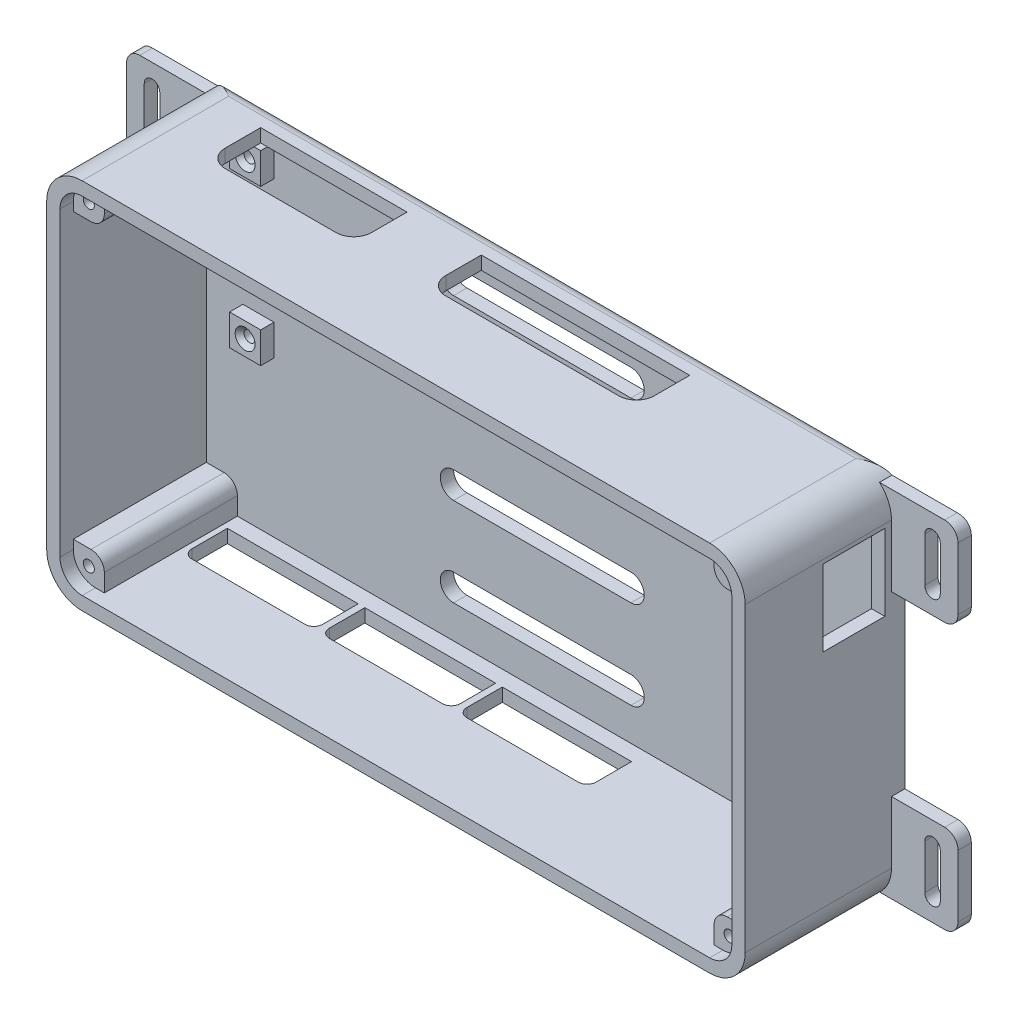
from build123d import *

# Parameters (mm, degrees)
SCHIZZO2_W                     = 151.5
SCHIZZO2_H                     = 78
ESTRUSIONE_ESTRUSIONE1_DEPTH   = 33
SCHIZZO2_3_R                   = 1.25
ESTRUSIONE_ESTRUSIONE2_DEPTH   = 30
TAGLIO_ESTRUSIONE1_DEPTH       = 3
TAGLIO_ESTRUSIONE2_REACH       = 168.311
SCHIZZO4_W                     = 14
SCHIZZO4_H                     = 17.18368822
SCHIZZO6_W                     = 7
SCHIZZO6_H                     = 7
SCHIZZO6_R                     = 1.25
ESTRUSIONE_ESTRUSIONE3_DEPTH   = 3
ESTRUSIONE_ESTRUSIONE3_2_DEPTH = 3
ESTRUSIONE_ESTRUSIONE3_3_DEPTH = 3
ESTRUSIONE_ESTRUSIONE3_4_DEPTH = 3
SMUSSO1_SIZE                   = 1
SMUSSO2_SIZE                   = 1
SMUSSO3_SIZE                   = 1
SMUSSO4_SIZE                   = 1
TAGLIO_ESTRUSIONE3_DEPTH       = 3
SCHIZZO7_W                     = 157.5
SCHIZZO7_H                     = 84
ESTRUSIONE_ESTRUSIONE4_DEPTH   = 3
SCHIZZO8_R                     = 1.25
TAGLIO_ESTRUSIONE4_DEPTH       = 13
ESTRUSIONE_ESTRUSIONE5_DEPTH   = 3
RACCORDO2_R                    = 8
RACCORDO3_R                    = 5
RACCORDO4_R                    = 5
RACCORDO5_R                    = 8
RACCORDO8_START                = -94
RACCORDO8_DEPTH                = 188
TAGLIO_ESTRUSIONE5_DEPTH       = 10


with BuildPart() as part:
    # Schizzo2 → Estrusione-Estrusione1 (new body)
    with BuildSketch(Plane.XY):
        Polygon((-78.75, 39), (-78.75, 42), (78.75, 42), (78.75, 39), (78.75, -39), (78.75, -42), (-78.75, -42), (-78.75, -39), align=None)
        Rectangle(SCHIZZO2_W, SCHIZZO2_H, mode=Mode.SUBTRACT)
    extrude(amount=ESTRUSIONE_ESTRUSIONE1_DEPTH)

    # Schizzo2<3> → Estrusione-Estrusione2 (add)
    # profile 1 of 4: a face of its own
    with BuildSketch(Plane.XY):
        with BuildLine():
            Line((68.75, -39), (75.75, -39))
            Line((75.75, -39), (75.75, -32))
            Line((75.75, -32), (71.75, -32))
            ThreePointArc((71.75, -32), (69.628679656, -32.878679656), (68.75, -35))
            Line((68.75, -35), (68.75, -39))
        make_face()
        with Locations((72.25, -35.5)):
            Circle(SCHIZZO2_3_R, mode=Mode.SUBTRACT)
    # profile 2 of 4: a face of its own
    with BuildSketch(Plane.XY):
        with BuildLine():
            Line((-75.75, -39), (-68.75, -39))
            Line((-68.75, -39), (-68.75, -35))
            ThreePointArc((-68.75, -35), (-69.628679656, -32.878679656), (-71.75, -32))
            Line((-71.75, -32), (-75.75, -32))
            Line((-75.75, -32), (-75.75, -39))
        make_face()
        with Locations((-72.25, -35.5)):
            Circle(SCHIZZO2_3_R, mode=Mode.SUBTRACT)
    # profile 3 of 4: a face of its own
    with BuildSketch(Plane.XY):
        with BuildLine():
            Line((71.75, 32), (75.75, 32))
            Line((75.75, 32), (75.75, 39))
            Line((75.75, 39), (68.75, 39))
            Line((68.75, 39), (68.75, 35))
            ThreePointArc((68.75, 35), (69.628679656, 32.878679656), (71.75, 32))
        make_face()
        with Locations((72.25, 35.5)):
            Circle(SCHIZZO2_3_R, mode=Mode.SUBTRACT)
    # profile 4 of 4: a face of its own
    with BuildSketch(Plane.XY):
        with BuildLine():
            Line((-75.75, 39), (-75.75, 32))
            Line((-75.75, 32), (-71.75, 32))
            ThreePointArc((-71.75, 32), (-69.628679656, 32.878679656), (-68.75, 35))
            Line((-68.75, 35), (-68.75, 39))
            Line((-68.75, 39), (-75.75, 39))
        make_face()
        with Locations((-72.25, 35.5)):
            Circle(SCHIZZO2_3_R, mode=Mode.SUBTRACT)
    extrude(amount=ESTRUSIONE_ESTRUSIONE2_DEPTH)

    # Schizzo3 → Taglio-Estrusione1 (cut)
    with BuildSketch(Plane(origin=(0, 42, 0), x_dir=(1, 0, 0), z_dir=(0, 1, 0))):
        with BuildLine():
            Line((-61, -2.5), (-61, -10.5))
            ThreePointArc((-61, -10.5), (-59.828427125, -13.328427125), (-57, -14.5))
            Line((-57, -14.5), (-32, -14.5))
            ThreePointArc((-32, -14.5), (-29.171572875, -13.328427125), (-28, -10.5))
            Line((-28, -10.5), (-28, -2.5))
            Line((-28, -2.5), (-61, -2.5))
        make_face()
        with BuildLine():
            Line((-11.25, -2.5), (-11.25, -10.5))
            ThreePointArc((-11.25, -10.5), (-10.078427125, -13.328427125), (-7.25, -14.5))
            Line((-7.25, -14.5), (31.75, -14.5))
            ThreePointArc((31.75, -14.5), (34.578427125, -13.328427125), (35.75, -10.5))
            Line((35.75, -10.5), (35.75, -2.5))
            Line((35.75, -2.5), (-11.25, -2.5))
        make_face()
    extrude(amount=-TAGLIO_ESTRUSIONE1_DEPTH, mode=Mode.SUBTRACT)

    # Taglio-Estrusione2: up to this face of the body (flat: up to its plane)
    taglio_estrusione2_end = Plane(part.part.faces().sort_by_distance((68.75, 37, 15))[0])
    # Schizzo4 → Taglio-Estrusione2 (cut, up to the picked face)
    with BuildSketch(Plane(origin=(78.75, 0, 0), x_dir=(0, 0, -1), z_dir=(1, 0, 0)), mode=Mode.PRIVATE) as taglio_estrusione2_sk1:
        with Locations((-8.5, 24.524535237)):
            Rectangle(SCHIZZO4_W, SCHIZZO4_H)
    taglio_estrusione2_tool1 = split(extrude(taglio_estrusione2_sk1.sketch, amount=-TAGLIO_ESTRUSIONE2_REACH, mode=Mode.PRIVATE), bisect_by=taglio_estrusione2_end, keep=Keep.BOTH, mode=Mode.PRIVATE)
    add(taglio_estrusione2_tool1.solids().sort_by(Axis((78.75, 24.524535, 8.5), (-1, 0, 0)))[0], mode=Mode.SUBTRACT)

    # Schizzo5 → Taglio-Estrusione3 (cut)
    with BuildSketch(Plane.XZ.offset(42)):
        with BuildLine():
            Line((-67.507731835, 3.5), (-67.507731835, 11.5))
            ThreePointArc((-67.507731835, 11.5), (-66.921945398, 12.914213562), (-65.507731835, 13.5))
            Line((-65.507731835, 13.5), (-55.507731835, 13.5))
            Line((-55.507731835, 13.5), (-50.007731835, 13.5))
            Line((-50.007731835, 13.5), (-40.007731835, 13.5))
            ThreePointArc((-40.007731835, 13.5), (-38.593518273, 12.914213562), (-38.007731835, 11.5))
            Line((-38.007731835, 11.5), (-38.007731835, 3.5))
            Line((-38.007731835, 3.5), (-67.507731835, 3.5))
        make_face()
        with BuildLine():
            Line((23.630484333, 3.5), (23.630484333, 11.5))
            ThreePointArc((23.630484333, 11.5), (23.044697895, 12.914213562), (21.630484333, 13.5))
            Line((21.630484333, 13.5), (11.992268165, 13.5))
            Line((11.992268165, 13.5), (-3.507731835, 13.5))
            ThreePointArc((-3.507731835, 13.5), (-4.921945398, 12.914213562), (-5.507731835, 11.5))
            Line((-5.507731835, 11.5), (-5.507731835, 3.5))
            Line((-5.507731835, 3.5), (9.992268165, 3.5))
            Line((9.992268165, 3.5), (23.630484333, 3.5))
        make_face()
        with BuildLine():
            Line((-36.507731835, 3.5), (-36.507731835, 11.5))
            ThreePointArc((-36.507731835, 11.5), (-35.921945398, 12.914213562), (-34.507731835, 13.5))
            Line((-34.507731835, 13.5), (-19.007731835, 13.5))
            Line((-19.007731835, 13.5), (-9.007731835, 13.5))
            ThreePointArc((-9.007731835, 13.5), (-7.593518273, 12.914213562), (-7.007731835, 11.5))
            Line((-7.007731835, 11.5), (-7.007731835, 3.5))
            Line((-7.007731835, 3.5), (-21.007731835, 3.5))
            Line((-21.007731835, 3.5), (-36.507731835, 3.5))
        make_face()
    extrude(amount=-TAGLIO_ESTRUSIONE3_DEPTH, mode=Mode.SUBTRACT)



with BuildPart() as body_2:
    # Schizzo6 → Estrusione-Estrusione3 (new body)
    with BuildSketch(Plane(origin=(0, 0, 0), x_dir=(-1, 0, 0), z_dir=(0, 0, -1))):
        with Locations((64, 34.5)):
            Rectangle(SCHIZZO6_W, SCHIZZO6_H)
        with Locations((64, 34.5)):
            Circle(SCHIZZO6_R, mode=Mode.SUBTRACT)
    extrude(amount=-ESTRUSIONE_ESTRUSIONE3_DEPTH)

    # Smusso1
    smusso1_edges = [body_2.edges().sort_by_distance(p)[0] for p in [
        (-62.75, 34.5, 3),
    ]]
    chamfer(smusso1_edges, length=SMUSSO1_SIZE)


with BuildPart() as body_3:
    # Schizzo6 → Estrusione-Estrusione3 2 (new body)
    with BuildSketch(Plane(origin=(0, 0, 0), x_dir=(-1, 0, 0), z_dir=(0, 0, -1))):
        with Locations((64, -0.5)):
            Rectangle(SCHIZZO6_W, SCHIZZO6_H)
        with Locations((64, -0.5)):
            Circle(SCHIZZO6_R, mode=Mode.SUBTRACT)
    extrude(amount=-ESTRUSIONE_ESTRUSIONE3_2_DEPTH)

    # Smusso2
    smusso2_edges = [body_3.edges().sort_by_distance(p)[0] for p in [
        (-62.75, -0.5, 3),
    ]]
    chamfer(smusso2_edges, length=SMUSSO2_SIZE)


with BuildPart() as body_4:
    # Schizzo6 → Estrusione-Estrusione3 3 (new body)
    with BuildSketch(Plane(origin=(0, 0, 0), x_dir=(-1, 0, 0), z_dir=(0, 0, -1))):
        with Locations((-64, 34.5)):
            Rectangle(SCHIZZO6_W, SCHIZZO6_H)
        with Locations(Location((-64, 34.5, 0), (0, 0, 180))):
            Circle(SCHIZZO6_R, mode=Mode.SUBTRACT)
    extrude(amount=-ESTRUSIONE_ESTRUSIONE3_3_DEPTH)

    # Smusso3
    smusso3_edges = [body_4.edges().sort_by_distance(p)[0] for p in [
        (62.75, 34.5, 3),
    ]]
    chamfer(smusso3_edges, length=SMUSSO3_SIZE)


with BuildPart() as body_5:
    # Schizzo6 → Estrusione-Estrusione3 4 (new body)
    with BuildSketch(Plane(origin=(0, 0, 0), x_dir=(-1, 0, 0), z_dir=(0, 0, -1))):
        with Locations((-64, -34.5)):
            Rectangle(SCHIZZO6_W, SCHIZZO6_H)
        with Locations((-64, -34.5)):
            Circle(SCHIZZO6_R, mode=Mode.SUBTRACT)
    extrude(amount=-ESTRUSIONE_ESTRUSIONE3_4_DEPTH)

    # Smusso4
    smusso4_edges = [body_5.edges().sort_by_distance(p)[0] for p in [
        (65.25, -34.5, 3),
    ]]
    chamfer(smusso4_edges, length=SMUSSO4_SIZE)


with BuildPart() as part_1:
    add(part.part)

    add(body_2.part)  # Estrusione-Estrusione4 merges body 2

    add(body_3.part)  # Estrusione-Estrusione4 merges body 3

    add(body_4.part)  # Estrusione-Estrusione4 merges body 4

    add(body_5.part)  # Estrusione-Estrusione4 merges body 5
    # Schizzo7 → Estrusione-Estrusione4 (add)
    with BuildSketch(Plane(origin=(0, 0, 0), x_dir=(-1, 0, 0), z_dir=(0, 0, -1))):
        Rectangle(SCHIZZO7_W, SCHIZZO7_H)
    extrude(amount=ESTRUSIONE_ESTRUSIONE4_DEPTH)

    # Schizzo8 → Taglio-Estrusione4 (cut)
    with BuildSketch(Plane(origin=(0, 0, -3), x_dir=(-1, 0, 0), z_dir=(0, 0, -1))):
        with Locations((-64, 34.5)):
            Circle(SCHIZZO8_R)
        with Locations((64, 34.5)):
            Circle(SCHIZZO8_R)
        with Locations((64, -0.5)):
            Circle(SCHIZZO8_R)
        with Locations((-64, -34.5)):
            Circle(SCHIZZO8_R)
    extrude(amount=-TAGLIO_ESTRUSIONE4_DEPTH, mode=Mode.SUBTRACT)

    # Schizzo9 → Estrusione-Estrusione5 (add)
    # profile 1 of 4: a face of its own
    with BuildSketch(Plane(origin=(0, 0, -3), x_dir=(-1, 0, 0), z_dir=(0, 0, -1))):
        with BuildLine():
            Line((-78.75, 20), (-78.75, 40))
            Line((-78.75, 40), (-90.75, 40))
            ThreePointArc((-90.75, 40), (-92.871320344, 39.121320344), (-93.75, 37))
            Line((-93.75, 37), (-93.75, 23))
            ThreePointArc((-93.75, 23), (-92.871320344, 20.878679656), (-90.75, 20))
            Line((-90.75, 20), (-78.75, 20))
        make_face()
        with BuildLine():
            Line((-89.75, 25), (-89.75, 35))
            ThreePointArc((-89.75, 35), (-88, 36.75), (-86.25, 35))
            Line((-86.25, 35), (-86.25, 25))
            ThreePointArc((-86.25, 25), (-88, 23.25), (-89.75, 25))
        make_face(mode=Mode.SUBTRACT)
    # profile 2 of 4: a face of its own
    with BuildSketch(Plane(origin=(0, 0, -3), x_dir=(-1, 0, 0), z_dir=(0, 0, -1))):
        with BuildLine():
            Line((78.75, 20), (90.75, 20))
            ThreePointArc((90.75, 20), (92.871320344, 20.878679656), (93.75, 23))
            Line((93.75, 23), (93.75, 37))
            ThreePointArc((93.75, 37), (92.871320344, 39.121320344), (90.75, 40))
            Line((90.75, 40), (78.75, 40))
            Line((78.75, 40), (78.75, 20))
        make_face()
        with BuildLine():
            Line((89.75, 25), (89.75, 35))
            ThreePointArc((89.75, 35), (88, 36.75), (86.25, 35))
            Line((86.25, 35), (86.25, 25))
            ThreePointArc((86.25, 25), (88, 23.25), (89.75, 25))
        make_face(mode=Mode.SUBTRACT)
    # profile 3 of 4: a face of its own
    with BuildSketch(Plane(origin=(0, 0, -3), x_dir=(-1, 0, 0), z_dir=(0, 0, -1))):
        with BuildLine():
            Line((78.75, -20), (78.75, -40))
            Line((78.75, -40), (90.75, -40))
            ThreePointArc((90.75, -40), (92.871320344, -39.121320344), (93.75, -37))
            Line((93.75, -37), (93.75, -23))
            ThreePointArc((93.75, -23), (92.871320344, -20.878679656), (90.75, -20))
            Line((90.75, -20), (78.75, -20))
        make_face()
        with BuildLine():
            Line((89.75, -25), (89.75, -35))
            ThreePointArc((89.75, -35), (88, -36.75), (86.25, -35))
            Line((86.25, -35), (86.25, -25))
            ThreePointArc((86.25, -25), (88, -23.25), (89.75, -25))
        make_face(mode=Mode.SUBTRACT)
    # profile 4 of 4: a face of its own
    with BuildSketch(Plane(origin=(0, 0, -3), x_dir=(-1, 0, 0), z_dir=(0, 0, -1))):
        with BuildLine():
            Line((-78.75, -20), (-90.75, -20))
            ThreePointArc((-90.75, -20), (-92.871320344, -20.878679656), (-93.75, -23))
            Line((-93.75, -23), (-93.75, -37))
            ThreePointArc((-93.75, -37), (-92.871320344, -39.121320344), (-90.75, -40))
            Line((-90.75, -40), (-78.75, -40))
            Line((-78.75, -40), (-78.75, -20))
        make_face()
        with BuildLine():
            Line((-89.75, -25), (-89.75, -35))
            ThreePointArc((-89.75, -35), (-88, -36.75), (-86.25, -35))
            Line((-86.25, -35), (-86.25, -25))
            ThreePointArc((-86.25, -25), (-88, -23.25), (-89.75, -25))
        make_face(mode=Mode.SUBTRACT)
    extrude(amount=-ESTRUSIONE_ESTRUSIONE5_DEPTH)

    # Raccordo2
    raccordo2_edges = [part_1.edges().sort_by_distance(p)[0] for p in [
        (78.75, 42, 15),
    ]]
    fillet(raccordo2_edges, radius=RACCORDO2_R)

    # Raccordo3
    raccordo3_edges = [part_1.edges().sort_by_distance(p)[0] for p in [
        (75.75, 39, 31.5),
    ]]
    fillet(raccordo3_edges, radius=RACCORDO3_R)

    # Raccordo4
    raccordo4_edges = [part_1.edges().sort_by_distance(p)[0] for p in [
        (75.75, -39, 31.5),
        (-75.75, 39, 31.5),
        (-75.75, -39, 31.5),
    ]]
    fillet(raccordo4_edges, radius=RACCORDO4_R)

    # Raccordo5
    raccordo5_edges = [part_1.edges().sort_by_distance(p)[0] for p in [
        (-78.75, 42, 15),
        (-78.75, -42, 15),
        (78.75, -42, 15),
    ]]
    fillet(raccordo5_edges, radius=RACCORDO5_R)

    # Raccordo8: read off the stored shape, not the designer's step
    # Raccordo8 outline → Raccordo8 (cut)
    with BuildSketch(Plane.YZ.offset(RACCORDO8_START)):
        with BuildLine():
            Line((42, -3), (42, 0))
            ThreePointArc((42, 0), (41.121320344, -2.121320344), (39, -3))
            Line((39, -3), (42, -3))
        make_face()
    extrude(amount=RACCORDO8_DEPTH, mode=Mode.SUBTRACT)

    # Schizzo10 → Taglio-Estrusione5 (cut)
    with BuildSketch(Plane.XY):
        with BuildLine():
            Line((20, 28.442828009), (-20, 28.442828009))
            ThreePointArc((-20, 28.442828009), (-23, 31.442828009), (-20, 34.442828009))
            Line((-20, 34.442828009), (20, 34.442828009))
            ThreePointArc((20, 34.442828009), (23, 31.442828009), (20, 28.442828009))
        make_face()
        with BuildLine():
            Line((20, 8.442828009), (-20, 8.442828009))
            ThreePointArc((-20, 8.442828009), (-23, 11.442828009), (-20, 14.442828009))
            Line((-20, 14.442828009), (20, 14.442828009))
            ThreePointArc((20, 14.442828009), (23, 11.442828009), (20, 8.442828009))
        make_face()
        with BuildLine():
            Line((20, -11.557171991), (-20, -11.557171991))
            ThreePointArc((-20, -11.557171991), (-23, -8.557171991), (-20, -5.557171991))
            Line((-20, -5.557171991), (20, -5.557171991))
            ThreePointArc((20, -5.557171991), (23, -8.557171991), (20, -11.557171991))
        make_face()
        with BuildLine():
            Line((20, -31.557171991), (-20, -31.557171991))
            ThreePointArc((-20, -31.557171991), (-23, -28.557171991), (-20, -25.557171991))
            Line((-20, -25.557171991), (20, -25.557171991))
            ThreePointArc((20, -25.557171991), (23, -28.557171991), (20, -31.557171991))
        make_face()
    extrude(amount=-TAGLIO_ESTRUSIONE5_DEPTH, mode=Mode.SUBTRACT)


solid = part_1.part
